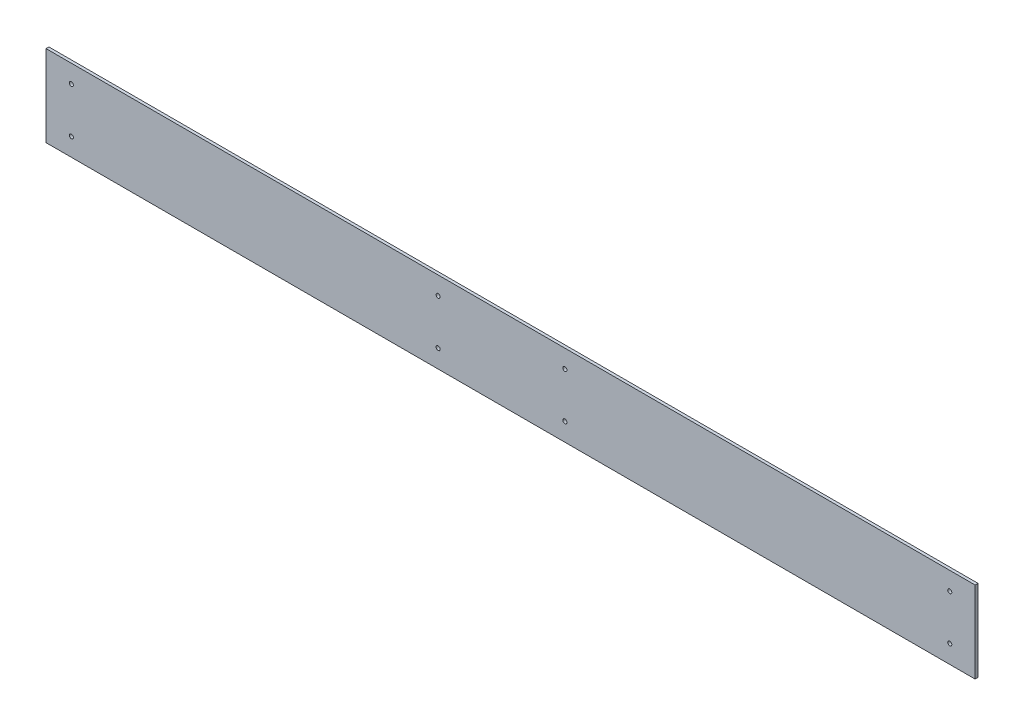
from build123d import *

# Parameters (mm, degrees)
SKETCH1_W            = 1026
SKETCH1_H            = 90
BOSS_EXTRUDE1_DEPTH  = 3.175
M4_CLEARANCE_HOLE1_D = 4.5


with BuildPart() as part:
    # Sketch1 → Boss-Extrude1 (new body)
    with BuildSketch(Plane.XY):
        Rectangle(SKETCH1_W, SKETCH1_H)
    extrude(amount=BOSS_EXTRUDE1_DEPTH)

    # M4 Clearance Hole1 (through all)
    with Locations(Plane.XY.offset(3.175)):
        with Locations((-485, 25), (-485, -25), (485, -25), (485, 25), (-80, 25), (-80, -25), (60, 25), (60, -25)):
            Hole(M4_CLEARANCE_HOLE1_D / 2)


solid = part.part
